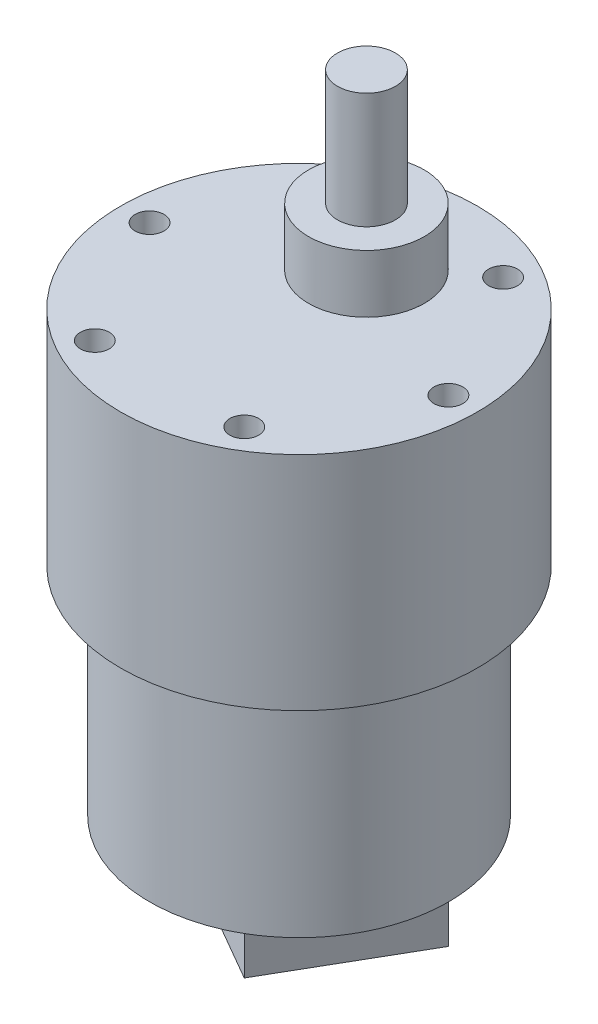
from build123d import *

# Parameters (mm, degrees)
SKETCH_1_R      = 18.5
SKETCH_1_R_2    = 1.5
SKETCH_1_R_3    = 6
EXTRUDE_1_DEPTH = 23
SKETCH_2_R      = 6
EXTRUDE_2_DEPTH = 6
SKETCH_4_R      = 3
EXTRUDE_3_DEPTH = 12
SKETCH_5_R      = 15.5
EXTRUDE_4_DEPTH = 22.5
SKETCH_6_R      = 5.5
EXTRUDE_5_DEPTH = 3
EXTRUDE_6_DEPTH = 4


with BuildPart() as part:
    # 草图1 → 凸台-拉伸1 (new body)
    with BuildSketch(Plane(origin=(0, 0, 0), x_dir=(1, 0, 0), z_dir=(0, 1, 0))):
        with Locations((2.003468414, 0)):
            Circle(SKETCH_1_R)
        with Locations((-13.496531586, 0)):
            Circle(SKETCH_1_R_2, mode=Mode.SUBTRACT)
        with Locations((2.003468414, 7)):
            Circle(SKETCH_1_R_3, mode=Mode.SUBTRACT)
        with Locations((-5.748265793, 13.420390024)):
            Circle(SKETCH_1_R_2, mode=Mode.SUBTRACT)
        with Locations((9.748265793, 13.420390024)):
            Circle(SKETCH_1_R_2, mode=Mode.SUBTRACT)
        with Locations((17.496531586, 0)):
            Circle(SKETCH_1_R_2, mode=Mode.SUBTRACT)
        with Locations((9.748265793, -13.420390024)):
            Circle(SKETCH_1_R_2, mode=Mode.SUBTRACT)
        with Locations((-5.748265793, -13.420390024)):
            Circle(SKETCH_1_R_2, mode=Mode.SUBTRACT)
    extrude(amount=EXTRUDE_1_DEPTH)

    # 草图2 → 凸台-拉伸2 (add)
    with BuildSketch(Plane(origin=(0, 23, 0), x_dir=(1, 0, 0), z_dir=(0, 1, 0))):
        with Locations((2.000422269, 6.994601852)):
            Circle(SKETCH_2_R)
    extrude(amount=EXTRUDE_2_DEPTH)

    # 草图4 → 凸台-拉伸3 (add)
    with BuildSketch(Plane(origin=(0, 29, 0), x_dir=(1, 0, 0), z_dir=(0, 1, 0))):
        with Locations((2.003234334, 6.996573555)):
            Circle(SKETCH_4_R)
    extrude(amount=EXTRUDE_3_DEPTH)

    # 草图5 → 凸台-拉伸4 (add)
    with BuildSketch(Plane.XZ):
        with Locations((2.003468414, 0)):
            Circle(SKETCH_5_R)
    extrude(amount=EXTRUDE_4_DEPTH)

    # 草图6 → 凸台-拉伸5 (add)
    with BuildSketch(Plane.XZ.offset(22.5)):
        with Locations((2.003468414, 0)):
            Circle(SKETCH_6_R)
    extrude(amount=EXTRUDE_5_DEPTH)

    # 草图7 → 凸台-拉伸6 (add)
    with BuildSketch(Plane.XZ.offset(22.5)):
        Polygon((9.748265793, 13.420390024), (17.496531586, 0), (11.951647133, -3.201340532), (4.20338134, 10.219049493), align=None)
    extrude(amount=EXTRUDE_6_DEPTH)


solid = part.part
